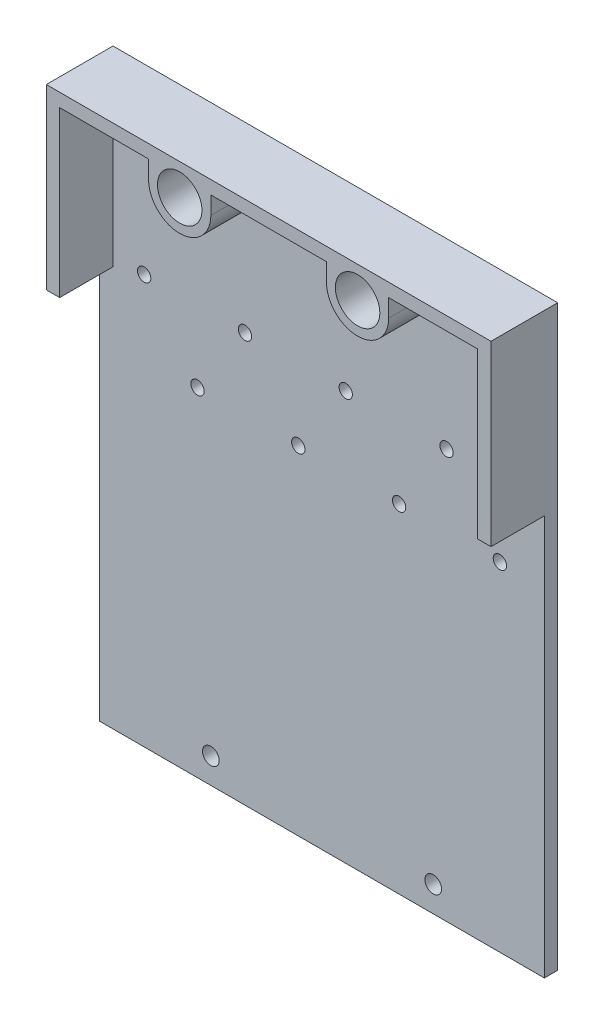
from build123d import *

# Parameters (mm, degrees)
SKETCH1_R              = 1.875
SKETCH1_R_2            = 5
BOSS_EXTRUDE1_DEPTH    = 3
CUT_EXTRUDE1_OUTLINE_R = 1.5
CUT_EXTRUDE1_DEPTH     = 3
LPATTERN1_COUNT        = 4
LPATTERN1_PITCH        = 22.666666667
SKETCH1_4_W            = 20
SKETCH1_4_H            = 3
SKETCH1_4_W_2          = 26
BOSS_EXTRUDE2_DEPTH    = 15


# Read off the part's stored shape, not the designer's step: Cut-Extrude1
with BuildPart() as part:
    # Sketch1 → Boss-Extrude1 (new body)
    with BuildSketch(Plane.XY):
        Polygon((77, 130), (63, 130), (63, 127), (37, 127), (37, 130), (23, 130), (23, 127), (3, 127), (3, 130), (0, 130), (0, 0), (100, 0), (100, 130), (97, 130), (97, 127), (77, 127), align=None)
        with Locations((25, 5.75)):
            Circle(SKETCH1_R, mode=Mode.SUBTRACT)
        with Locations((75, 5.75)):
            Circle(SKETCH1_R, mode=Mode.SUBTRACT)
        with BuildLine():
            ThreePointArc((37, 123), (30, 116), (23, 123))
            Line((23, 123), (25, 123))
            ThreePointArc((25, 123), (30, 128), (35, 123))
            Line((35, 123), (37, 123))
        make_face(mode=Mode.SUBTRACT)
        with Locations((70, 123)):
            Circle(SKETCH1_R_2, mode=Mode.SUBTRACT)
    extrude(amount=BOSS_EXTRUDE1_DEPTH)

    # Cut-Extrude1 outline → Cut-Extrude1 (cut)
    with BuildSketch(Plane.XY):
        with Locations((22, 76)):
            Circle(CUT_EXTRUDE1_OUTLINE_R)
        with Locations((10, 92)):
            Circle(CUT_EXTRUDE1_OUTLINE_R)
    cut_extrude1 = extrude(amount=CUT_EXTRUDE1_DEPTH, mode=Mode.SUBTRACT)

    # LPattern1: Cut-Extrude1 ×4
    with Locations(*[(i * LPATTERN1_PITCH, 0, 0) for i in range(1, LPATTERN1_COUNT)]):
        add(cut_extrude1, mode=Mode.SUBTRACT)

    # Sketch1<4> → Boss-Extrude2 (add)
    with BuildSketch(Plane.XY):
        Polygon((0, 130), (0, 90), (3, 90), (3, 127), (3, 130), align=None)
        with Locations((13, 128.5)):
            Rectangle(SKETCH1_4_W, SKETCH1_4_H)
        Polygon((97, 90), (100, 90), (100, 130), (97, 130), (97, 127), align=None)
        with Locations((87, 128.5)):
            Rectangle(SKETCH1_4_W, SKETCH1_4_H)
        with BuildLine():
            Line((77, 127), (77, 130))
            Line((77, 130), (70, 130))
            ThreePointArc((70, 130), (74.949747468, 127.949747468), (77, 123))
            Line((77, 123), (77, 127))
        make_face()
        with BuildLine():
            ThreePointArc((63, 123), (65.050252532, 127.949747468), (70, 130))
            Line((70, 130), (63, 130))
            Line((63, 130), (63, 127))
            Line((63, 127), (63, 123))
        make_face()
        with BuildLine():
            ThreePointArc((77, 123), (74.949747468, 127.949747468), (70, 130))
            ThreePointArc((70, 130), (65.050252532, 127.949747468), (63, 123))
            Line((63, 123), (65, 123))
            ThreePointArc((65, 123), (70, 128), (75, 123))
            Line((75, 123), (77, 123))
        make_face()
        with BuildLine():
            ThreePointArc((63, 123), (70, 116), (77, 123))
            Line((77, 123), (75, 123))
            ThreePointArc((75, 123), (70, 118), (65, 123))
            Line((65, 123), (63, 123))
        make_face()
        with BuildLine():
            ThreePointArc((77, 123), (74.949747468, 127.949747468), (70, 130))
            ThreePointArc((70, 130), (65.050252532, 127.949747468), (63, 123))
            Line((63, 123), (65, 123))
            ThreePointArc((65, 123), (70, 128), (75, 123))
            Line((75, 123), (77, 123))
        make_face()
        with BuildLine():
            ThreePointArc((63, 123), (70, 116), (77, 123))
            Line((77, 123), (75, 123))
            ThreePointArc((75, 123), (70, 118), (65, 123))
            Line((65, 123), (63, 123))
        make_face()
        with Locations((50, 128.5)):
            Rectangle(SKETCH1_4_W_2, SKETCH1_4_H)
        with BuildLine():
            Line((37, 130), (30, 130))
            ThreePointArc((30, 130), (34.949747468, 127.949747468), (37, 123))
            Line((37, 123), (37, 127))
            Line((37, 127), (37, 130))
        make_face()
        with BuildLine():
            Line((30, 130), (23, 130))
            Line((23, 130), (23, 127))
            Line((23, 127), (23, 123))
            ThreePointArc((23, 123), (25.050252532, 127.949747468), (30, 130))
        make_face()
        with BuildLine():
            ThreePointArc((37, 123), (34.949747468, 127.949747468), (30, 130))
            ThreePointArc((30, 130), (25.050252532, 127.949747468), (23, 123))
            Line((23, 123), (25, 123))
            ThreePointArc((25, 123), (30, 128), (35, 123))
            Line((35, 123), (37, 123))
        make_face()
        with BuildLine():
            Line((25, 123), (23, 123))
            ThreePointArc((23, 123), (30, 116), (37, 123))
            Line((37, 123), (35, 123))
            ThreePointArc((35, 123), (30, 118), (25, 123))
        make_face()
        with BuildLine():
            ThreePointArc((37, 123), (34.949747468, 127.949747468), (30, 130))
            ThreePointArc((30, 130), (25.050252532, 127.949747468), (23, 123))
            Line((23, 123), (25, 123))
            ThreePointArc((25, 123), (30, 128), (35, 123))
            Line((35, 123), (37, 123))
        make_face()
        with BuildLine():
            Line((25, 123), (23, 123))
            ThreePointArc((23, 123), (30, 116), (37, 123))
            Line((37, 123), (35, 123))
            ThreePointArc((35, 123), (30, 118), (25, 123))
        make_face()
    extrude(amount=BOSS_EXTRUDE2_DEPTH)


solid = part.part
